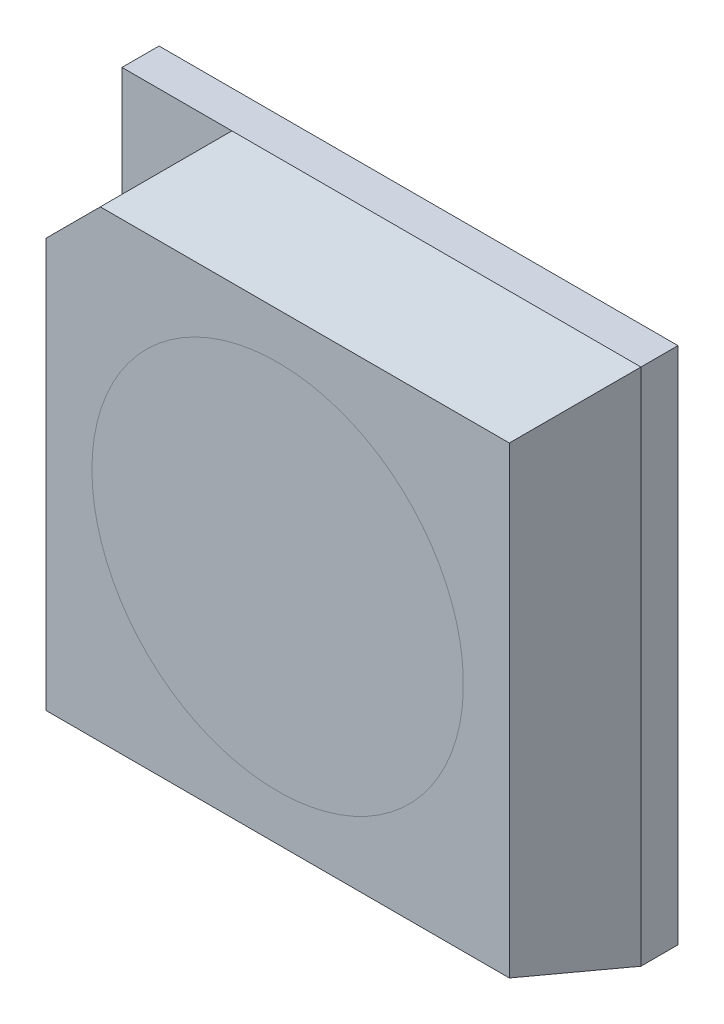
from build123d import *

# Parameters (mm, degrees)
SKETCH1_W             = 3.5
SKETCH1_H             = 3.5
BOSS_EXTRUDE1_DEPTH   = 0.25
SKETCH1_2_W           = 3.5
SKETCH1_2_H           = 3.5
BOSS_EXTRUDE2_DEPTH   = 0.7
BOSS_EXTRUDE2_TAPER   = 15
BOSS_EXTRUDE4_DEPTH   = 0.25
SKETCH2_R             = 0.240285244
BOSS_EXTRUDE4_2_DEPTH = 0.25
SKETCH2_R_2           = 0.29534045
BOSS_EXTRUDE4_3_DEPTH = 0.25
SKETCH2_R_3           = 0.338833711
BOSS_EXTRUDE4_4_DEPTH = 0.25
CUT_EXTRUDE1_DEPTH    = 3.57196423


with BuildPart() as part:
    # Sketch1 → Boss-Extrude1 (new body)
    with BuildSketch(Plane.XY):
        Rectangle(SKETCH1_W, SKETCH1_H)
    extrude(amount=-BOSS_EXTRUDE1_DEPTH)


with BuildPart() as body_2:
    # Sketch1<2> → Boss-Extrude2 (new body)
    with BuildSketch(Plane.XY):
        Rectangle(SKETCH1_2_W, SKETCH1_2_H)
    extrude(amount=BOSS_EXTRUDE2_DEPTH, taper=BOSS_EXTRUDE2_TAPER)

    # Sketch3 → Cut-Extrude1 (cut, through all)
    with BuildSketch(Plane.XY):
        Polygon((-1.75, 1.008567461), (-1.008567461, 1.75), (-1.75, 1.75), align=None)
    extrude(amount=CUT_EXTRUDE1_DEPTH, mode=Mode.SUBTRACT)


with BuildPart() as body_3:
    # Sketch2 → Boss-Extrude4 (new body)
    with BuildSketch(Plane.XY):
        Polygon((1.367739414, 0.566536215), (0.566536215, 1.367739414), (-0.566536215, 1.367739414), (-1.367739414, 0.566536215), (-1.367739414, -0.566536215), (-0.566536215, -1.367739414), (0.566536215, -1.367739414), (1.367739414, -0.566536215), align=None)
        Polygon((-0.483693502, 1.167739414), (0.483693502, 1.167739414), (1.167739414, 0.483693502), (1.167739414, -0.483693502), (0.483693502, -1.167739414), (-0.483693502, -1.167739414), (-1.167739414, -0.483693502), (-1.167739414, 0.483693502), align=None, mode=Mode.SUBTRACT)
    extrude(amount=BOSS_EXTRUDE4_DEPTH)


with BuildPart() as body_4:
    # Sketch2 → Boss-Extrude4 2 (new body)
    with BuildSketch(Plane.XY):
        with Locations((-0.483693502, 0.600735588)):
            Circle(SKETCH2_R)
    extrude(amount=BOSS_EXTRUDE4_2_DEPTH)


with BuildPart() as body_5:
    # Sketch2 → Boss-Extrude4 3 (new body)
    with BuildSketch(Plane.XY):
        with Locations((0.566536215, 0.166197507)):
            Circle(SKETCH2_R_2)
    extrude(amount=BOSS_EXTRUDE4_3_DEPTH)


with BuildPart() as body_6:
    # Sketch2 → Boss-Extrude4 4 (new body)
    with BuildSketch(Plane.XY):
        with Locations((-0.428114096, -0.428013867)):
            Circle(SKETCH2_R_3)
    extrude(amount=BOSS_EXTRUDE4_4_DEPTH)


solid = Compound([part.part, body_2.part, body_3.part, body_4.part, body_5.part, body_6.part])
